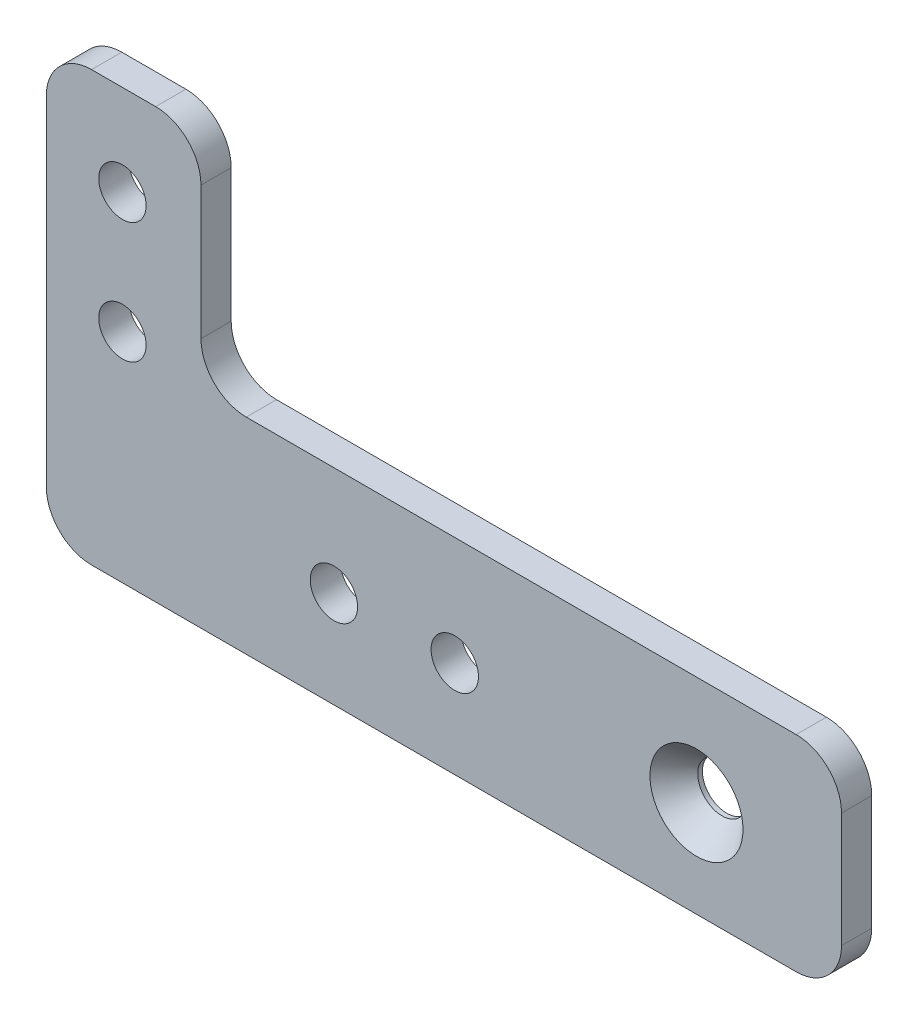
from build123d import *

# Parameters (mm, degrees)
SKETCH1_R                                       = 2.4892
BOSS_EXTRUDE1_DEPTH                             = 3.175
FILLET1_R                                       = 4.7625
CSK_FOR_10_FLAT_HEAD_MACHINE_SCREW1_D           = 5.1054
CSK_FOR_10_FLAT_HEAD_MACHINE_SCREW1_DEPTH       = 19.05
CSK_FOR_10_FLAT_HEAD_MACHINE_SCREW1_CSINK_D     = 9.779
CSK_FOR_10_FLAT_HEAD_MACHINE_SCREW1_CSINK_ANGLE = 82
CSK_FOR_10_FLAT_HEAD_MACHINE_SCREW1_TIP         = 1.533816902


with BuildPart() as part:
    # Sketch1 → Boss-Extrude1 (new body)
    with BuildSketch(Plane.XY):
        Polygon((-37.846, 23.8125), (-37.846, -21.2725), (45.72, -21.2725), (45.72, 0.3175), (-21.59, 0.3175), (-21.59, 23.8125), align=None)
        with Locations((-7.62, -11.1125)):
            Circle(SKETCH1_R, mode=Mode.SUBTRACT)
        with Locations((5.08, -11.1125)):
            Circle(SKETCH1_R, mode=Mode.SUBTRACT)
        with Locations((30.48, -11.1125)):
            Circle(SKETCH1_R, mode=Mode.SUBTRACT)
        with Locations((-29.845, 1.5875)):
            Circle(SKETCH1_R, mode=Mode.SUBTRACT)
        with Locations((-29.845, 14.2875)):
            Circle(SKETCH1_R, mode=Mode.SUBTRACT)
    extrude(amount=BOSS_EXTRUDE1_DEPTH)

    # Fillet1
    fillet1_edges = [part.edges().sort_by_distance(p)[0] for p in [
        (-37.846, 23.8125, 1.5875),
        (-21.59, 23.8125, 1.5875),
        (-21.59, 0.3175, 1.5875),
        (45.72, 0.3175, 1.5875),
        (45.72, -21.2725, 1.5875),
        (-37.846, -21.2725, 1.5875),
    ]]
    fillet(fillet1_edges, radius=FILLET1_R)

    # CSK for #10 Flat Head Machine Screw1
    with Locations(Plane.XY.offset(3.175)):
        with Locations((30.48, -11.1125)):
            CounterSinkHole(CSK_FOR_10_FLAT_HEAD_MACHINE_SCREW1_D / 2, CSK_FOR_10_FLAT_HEAD_MACHINE_SCREW1_CSINK_D / 2, depth=CSK_FOR_10_FLAT_HEAD_MACHINE_SCREW1_DEPTH, counter_sink_angle=CSK_FOR_10_FLAT_HEAD_MACHINE_SCREW1_CSINK_ANGLE)
            with Locations((0, 0, -(CSK_FOR_10_FLAT_HEAD_MACHINE_SCREW1_DEPTH + CSK_FOR_10_FLAT_HEAD_MACHINE_SCREW1_TIP / 2))):  # 118° drill point
                Cone(0, CSK_FOR_10_FLAT_HEAD_MACHINE_SCREW1_D / 2, CSK_FOR_10_FLAT_HEAD_MACHINE_SCREW1_TIP, mode=Mode.SUBTRACT)


solid = part.part
